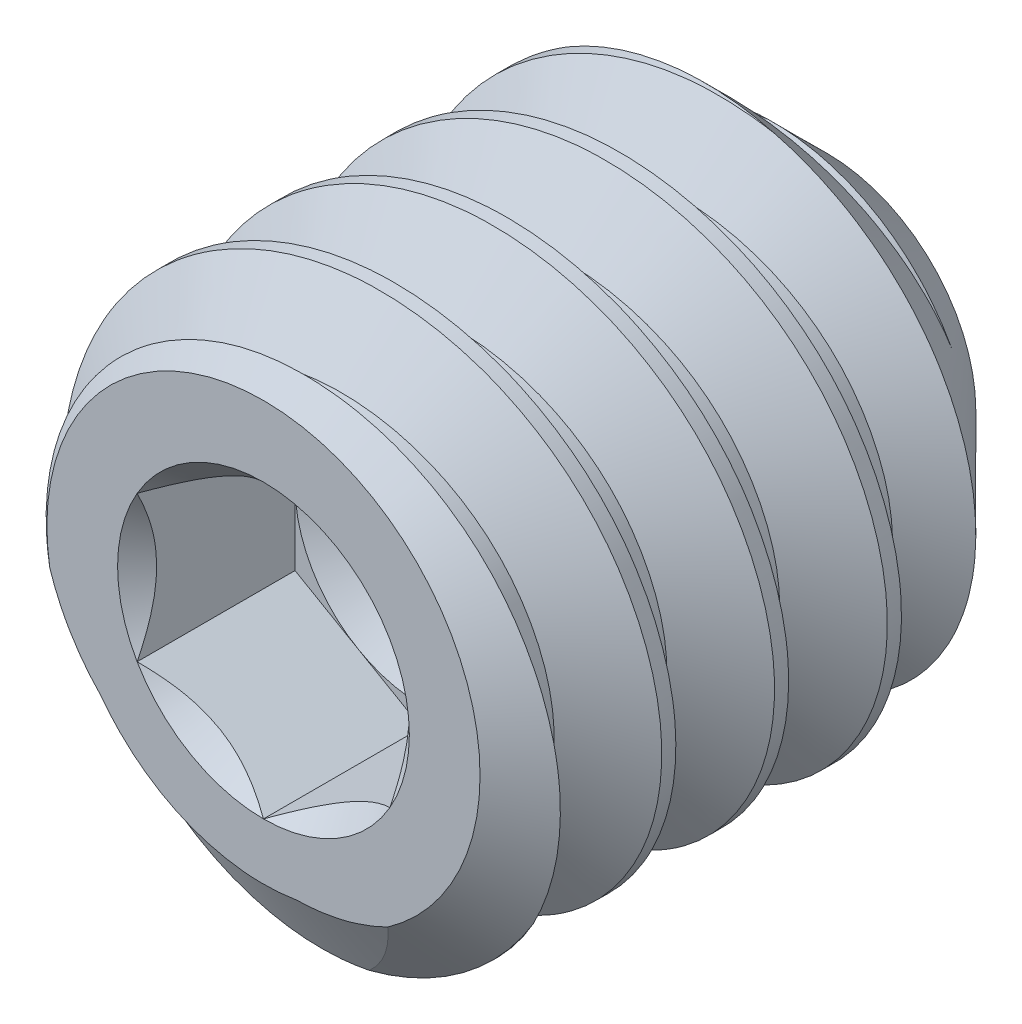
from build123d import *

# Parameters (mm, degrees)
CUT_SWEEP2_PITCH    = 0.3175
CUT_EXTRUDE10_DEPTH = 0.4445


with BuildPart() as part:
    # Sketch22 → Revolve1 (revolve)
    with BuildSketch(Plane(origin=(0, 0, 0), x_dir=(0, 0, -1), z_dir=(1, 0, 0)), mode=Mode.PRIVATE) as revolve1_sk:
        Polygon((-0.668305547, 0), (-0.668305547, 0.6096), (-0.561593918, 0.762), (0.574743712, 0.762), (0.919194453, 0.417549259), (0.668305547, 0), align=None)
    revolve(revolve1_sk.sketch.rotate(Axis((0, 0, -0.668305547), (0, 0, -1)), 180), axis=Axis((0, 0, -0.668305547), (0, 0, -1)))

    # Cut-Sweep2: the profile of Sketch28 profile screwed along a right-hand helix of 6.8 turns, 6 arcs to a turn; built about Z, then put on its axis
    cut_sweep2_z = Axis((0, 0, 0), (0, 0, 1))
    cut_sweep2_corners = [(0.7623, 0, 0.000173205), (0.7623, 0, -0.277985705), (0.569525854, 0, -0.1666875), (0.569525854, 0, -0.111125)]
    with BuildLine(mode=Mode.PRIVATE) as cut_sweep2_profile:
        Line(cut_sweep2_corners[0], cut_sweep2_corners[1])
        Line(cut_sweep2_corners[1], cut_sweep2_corners[2])
        Line(cut_sweep2_corners[2], cut_sweep2_corners[3])
        Line(cut_sweep2_corners[3], cut_sweep2_corners[0])
    cut_sweep2_cap = Face(cut_sweep2_profile.wire())
    cut_sweep2_turn_angles = [0, 30, 60, 90, 120, 150, 180, 210, 240, 270, 300, 330, 360]
    cut_sweep2_turn_weights = [1, 0.8660254037844387, 1, 0.8660254037844387, 1, 0.8660254037844387, 1, 0.8660254037844387, 1, 0.8660254037844387, 1, 0.8660254037844387, 1]
    cut_sweep2_turn_rails = [Edge.make_bspline([Vector(p[0], p[1], 0).rotate(cut_sweep2_z, cut_sweep2_turn_angles[k]) / cut_sweep2_turn_weights[k] + Vector(0, 0, p[2] + CUT_SWEEP2_PITCH * cut_sweep2_turn_angles[k] / 360) for k in range(13)], [0, 0, 0, 1, 1, 2, 2, 3, 3, 4, 4, 5, 5, 6, 6, 6], 2, cut_sweep2_turn_weights) for p in cut_sweep2_corners]
    cut_sweep2_turn_sides = [Face.make_surface_from_curves(cut_sweep2_turn_rails[p[0]], cut_sweep2_turn_rails[p[1]]) for p in [(0, 1), (1, 2), (2, 3), (3, 0)]]
    cut_sweep2_last_angles = [2160, 2190, 2220, 2250, 2280, 2310, 2340, 2370, 2400, 2424, 2448]
    cut_sweep2_last_weights = [1, 0.8660254037844387, 1, 0.8660254037844387, 1, 0.8660254037844387, 1, 0.8660254037844387, 1, 0.9135454576425863, 1]
    cut_sweep2_last_rails = [Edge.make_bspline([Vector(p[0], p[1], 0).rotate(cut_sweep2_z, cut_sweep2_last_angles[k]) / cut_sweep2_last_weights[k] + Vector(0, 0, p[2] + CUT_SWEEP2_PITCH * cut_sweep2_last_angles[k] / 360) for k in range(11)], [0, 0, 0, 1, 1, 2, 2, 3, 3, 4, 4, 5, 5, 5], 2, cut_sweep2_last_weights) for p in cut_sweep2_corners]
    cut_sweep2_last_sides = [Face.make_surface_from_curves(cut_sweep2_last_rails[p[0]], cut_sweep2_last_rails[p[1]]) for p in [(0, 1), (1, 2), (2, 3), (3, 0)]]
    cut_sweep2 = Plane(origin=(0, 0, -0.919194453), x_dir=(0, 1, 0), z_dir=(0, 0, 1)) * Solid(Shell([*[p.moved(Location((0, 0, CUT_SWEEP2_PITCH * i))) for i in range(6) for p in cut_sweep2_turn_sides], *cut_sweep2_last_sides, cut_sweep2_cap, cut_sweep2_cap.rotate(cut_sweep2_z, 2448).moved(Location((0, 0, CUT_SWEEP2_PITCH * 2448 / 360)))]))
    add(cut_sweep2, mode=Mode.SUBTRACT)

    # Sketch23 → Cut-Extrude10 (cut)
    with BuildSketch(Plane.XY.offset(0.668305547)):
        Polygon((0, 0.410611511), (-0.3556, 0.205305756), (-0.3556, -0.205305756), (0, -0.410611511), (0.3556, -0.205305756), (0.3556, 0.205305756), align=None)
    extrude(amount=-CUT_EXTRUDE10_DEPTH, mode=Mode.SUBTRACT)

    # Cut-Extrude11 cone 1 section (through the dimple's axis) → Cut-Extrude11 (revolve, cut)
    with BuildSketch(Plane(origin=(0, 0, 0.668305547), x_dir=(0, -1, 0), z_dir=(1, 0, 0))):
        Polygon((0, 0), (0.410611511, 0), (0, 0.410611511), align=None)
    revolve(axis=Axis((0, 0, 0.668305547), (0, 0, -1)), mode=Mode.SUBTRACT)

    # Cut-Extrude12 cone 1 section (through the dimple's axis) → Cut-Extrude12 (revolve, cut)
    with BuildSketch(Plane(origin=(0, 0, 0.223805547), x_dir=(0, -1, 0), z_dir=(1, 0, 0))):
        Polygon((0, 0), (0.3556, 0), (0, 0.205305756), align=None)
    revolve(axis=Axis((0, 0, 0.223805547), (0, 0, -1)), mode=Mode.SUBTRACT)


solid = part.part
